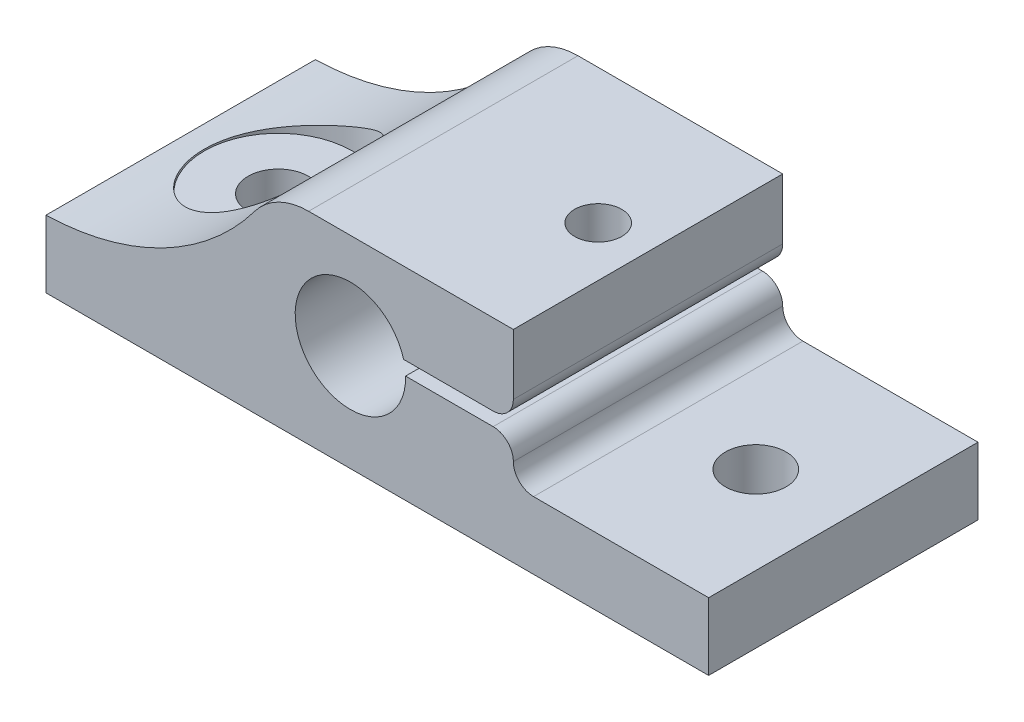
from build123d import *

# Parameters (mm, degrees)
RESSALTO_EXTRUS_O1_DEPTH   = 20
CORTE_EXTRUS_O1_DEPTH      = 35.724775606
CORTE_EXTRUS_O1_DEPTH_BACK = 35.724775606
ESBO_O2_R                  = 1.75
CORTE_EXTRUS_O2_DEPTH      = 3.5
FILETE1_R                  = 1.5
ESBO_O4_W                  = 2.5
ESBO_O4_H                  = 20
RESSALTO_EXTRUS_O2_DEPTH   = 5
ESBO_O5_R                  = 2.25
CORTE_EXTRUS_O3_DEPTH      = 35.749964678
FILETE2_DEPTH              = 7.7499999
FILETE2_START              = 12.2500001
FILETE2_2_DEPTH            = 7.7499999
FILETE2_START_2            = 7.7499999
FILETE2_3_DEPTH            = 4.5000002
FILETE2_START_3            = -2.9
FILETE2_4_OUTLINE_R        = 2.25
FILETE2_4_DEPTH            = 7.998725805
ESBO_O6_R                  = 5.5
CORTE_EXTRUS_O4_DEPTH      = 10


with BuildPart() as part:
    # Esboço1 → Ressalto-extrusão1 (new body)
    with BuildSketch(Plane.XY):
        with BuildLine():
            ThreePointArc((10.599999813, 0.1), (11.660659985, -0.339339828), (12.099999813, -1.4))
            Line((12.099999813, -1.4), (12.099999813, -2.9))
            Line((12.099999813, -2.9), (24.100000848, -2.9))
            Line((24.100000848, -2.9), (24.100000848, -7.9))
            Line((24.100000848, -7.9), (-20.099999152, -7.9))
            Line((-20.099999152, -7.9), (-20.099999152, -2.9))
            Line((-20.099999152, -2.9), (-8.099998116, -2.9))
            Line((-8.099998116, -2.9), (-8.099998116, 2.1))
            ThreePointArc((-8.099998116, 2.1), (-6.635532022, 5.635533906), (-3.099998116, 7.1))
            Line((-3.099998116, 7.1), (12.099999813, 7.1))
            Line((12.099999813, 7.1), (12.099999813, 2.6))
            ThreePointArc((12.099999813, 2.6), (11.660659985, 1.539339828), (10.599999813, 1.1))
            Line((10.599999813, 1.1), (3.949683532, 1.1))
            ThreePointArc((3.949683532, 1.1), (-4.055174785, -0.604613482), (4.098780306, 0.1))
            Line((4.098780306, 0.1), (10.599999813, 0.1))
        make_face()
    extrude(amount=RESSALTO_EXTRUS_O1_DEPTH)

    # Esboço2 → Corte-extrusão1 (cut, two sides: drawn at the far end of the back side and taken through both)
    with BuildSketch(Plane(origin=(0, 7.1, 0), x_dir=(1, 0, 0), z_dir=(0, 1, 0)).offset(-CORTE_EXTRUS_O1_DEPTH_BACK)):
        with Locations(Location((8.400001366, -10, 0), (0, 0, 180))):
            Circle(ESBO_O2_R)
    extrude(amount=CORTE_EXTRUS_O1_DEPTH + CORTE_EXTRUS_O1_DEPTH_BACK, mode=Mode.SUBTRACT)

    # Esboço3 → Corte-extrusão2 (cut)
    with BuildSketch(Plane.XZ.offset(7.9)):
        Polygon((8.400001366, 13.348631561), (5.500001366, 11.674315781), (5.500001366, 8.325684219), (8.400001366, 6.651368439), (11.300001366, 8.325684219), (11.300001366, 11.674315781), align=None)
    extrude(amount=-CORTE_EXTRUS_O2_DEPTH, mode=Mode.SUBTRACT)

    # Filete1
    filete1_edges = [part.edges().sort_by_distance(p)[0] for p in [
        (12.099999813, -2.9, 10),
    ]]
    fillet(filete1_edges, radius=FILETE1_R - 0.0001)  # a hair under: the kernel refuses the full size

    # Esboço4 → Ressalto-extrusão2 (add)
    with BuildSketch(Plane.XZ.offset(7.9)):
        with Locations((-21.349999152, 10)):
            Rectangle(ESBO_O4_W, ESBO_O4_H)
        with Locations((25.350000848, 10)):
            Rectangle(ESBO_O4_W, ESBO_O4_H)
    extrude(amount=-RESSALTO_EXTRUS_O2_DEPTH)

    # Esboço5 → Corte-extrusão3 (cut, through all)
    with BuildSketch(Plane(origin=(0, -2.9, 0), x_dir=(1, 0, 0), z_dir=(0, 1, 0))):
        with Locations(Location((-15.349998634, -10, 0), (0, 0, 180))):
            Circle(ESBO_O5_R)
        with Locations(Location((20.100000331, -10, 0), (0, 0, 180))):
            Circle(ESBO_O5_R)
    extrude(amount=-CORTE_EXTRUS_O3_DEPTH, mode=Mode.SUBTRACT)

    # Filete2: read off the stored shape, not the designer's step
    # Filete2 outline → Filete2 (add)
    with BuildSketch(Plane.XY):
        with BuildLine():
            ThreePointArc((-7.100953445, 5.098725805), (-13.932624155, -0.679149409), (-22.599999152, -2.9))
            Line((-22.599999152, -2.9), (-8.099998116, -2.9))
            Line((-8.099998116, -2.9), (-8.099998116, 2.1))
            ThreePointArc((-8.099998116, 2.1), (-7.843666351, 3.680383396), (-7.100953445, 5.098725805))
        make_face()
    extrude(amount=FILETE2_DEPTH)

    # Filete2 2 outline → Filete2 2 (add)
    with BuildSketch(Plane.XY.offset(FILETE2_START)):
        with BuildLine():
            ThreePointArc((-7.100953445, 5.098725805), (-13.932624155, -0.679149409), (-22.599999152, -2.9))
            Line((-22.599999152, -2.9), (-8.099998116, -2.9))
            Line((-8.099998116, -2.9), (-8.099998116, 2.1))
            ThreePointArc((-8.099998116, 2.1), (-7.843666351, 3.680383396), (-7.100953445, 5.098725805))
        make_face()
    extrude(amount=FILETE2_2_DEPTH)

    # Filete2 3 outline → Filete2 3 (add)
    with BuildSketch(Plane.XY.offset(FILETE2_START_2)):
        with BuildLine():
            ThreePointArc((-7.100953445, 5.098725805), (-13.932624155, -0.679149409), (-22.599999152, -2.9))
            Line((-22.599999152, -2.9), (-8.099998116, -2.9))
            Line((-8.099998116, -2.9), (-8.099998116, 2.099999998))
            ThreePointArc((-8.099998116, 2.099999998), (-7.843666351, 3.680383395), (-7.100953445, 5.098725805))
        make_face()
    extrude(amount=FILETE2_3_DEPTH)

    # Filete2 4 outline → Filete2 4 (cut)
    with BuildSketch(Plane(origin=(0, 0, 0), x_dir=(1, 0, 0), z_dir=(0, 1, 0)).offset(FILETE2_START_3)):
        with Locations((-15.349998634, -10)):
            Circle(FILETE2_4_OUTLINE_R)
    extrude(amount=FILETE2_4_DEPTH, mode=Mode.SUBTRACT)

    # Esboço6 → Corte-extrusão4 (cut)
    with BuildSketch(Plane(origin=(0, 7.1, 0), x_dir=(1, 0, 0), z_dir=(0, 1, 0))):
        with Locations(Location((-15.349998634, -10, 0), (0, 0, 180))):
            Circle(ESBO_O6_R)
    extrude(amount=-CORTE_EXTRUS_O4_DEPTH, mode=Mode.SUBTRACT)


solid = part.part
